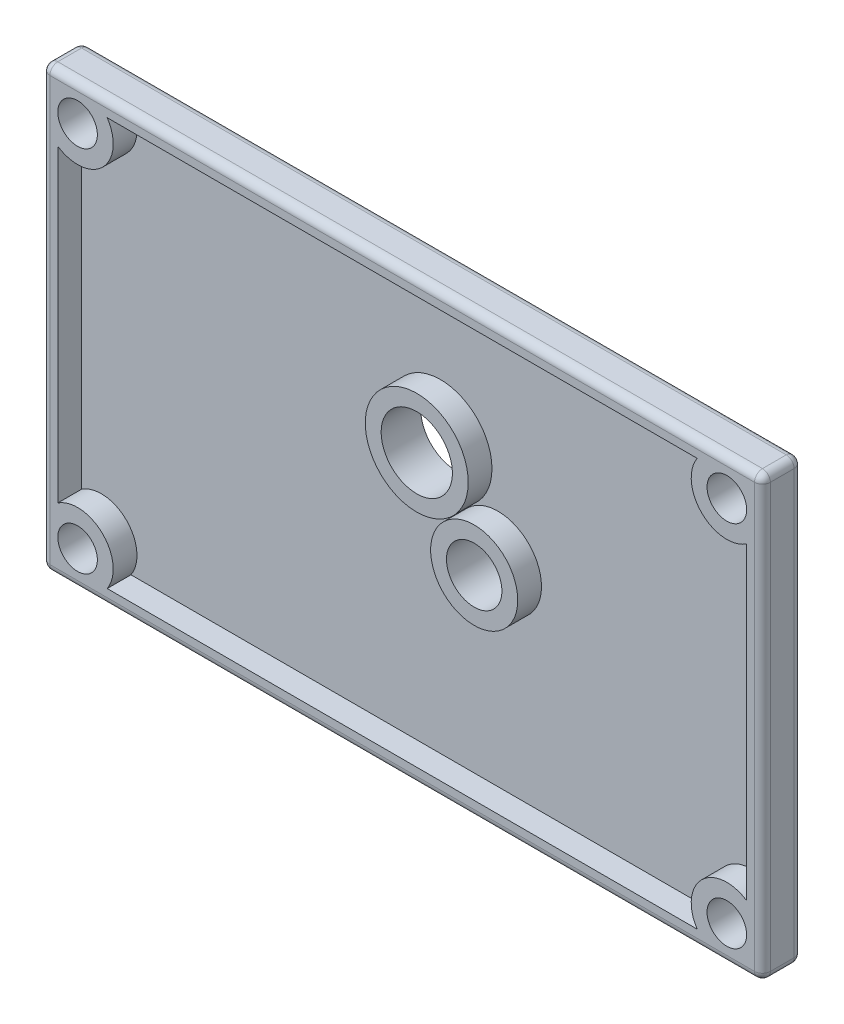
from build123d import *

# Parameters (mm, degrees)
SKETCH1_W           = 91
SKETCH1_H           = 55.5
BOSS_EXTRUDE1_DEPTH = 5
FILLET1_R           = 1
FILLET2_R           = 1
SKETCH3_R           = 2.5
SKETCH3_R_2         = 4.5
SKETCH3_R_3         = 3.5
CUT_EXTRUDE6_DEPTH  = 5
SHELL3_START        = 2
SHELL3_OUTLINE_R    = 5.5
SHELL3_OUTLINE_R_2  = 6.5
SHELL3_DEPTH        = 3


# Read off the part's stored shape, not the designer's step: Shell3
with BuildPart() as part:
    # Sketch1 → Boss-Extrude1 (new body)
    with BuildSketch(Plane.XY):
        with Locations((45.5, -27.75)):
            Rectangle(SKETCH1_W, SKETCH1_H)
    extrude(amount=BOSS_EXTRUDE1_DEPTH)

    # Fillet1
    fillet1_edges = [part.edges().sort_by_distance(p)[0] for p in [
        (0, -27.75, 5),
        (45.5, -55.5, 0),
        (0, -27.75, 0),
        (45.5, -55.5, 5),
        (0, 0, 2.5),
        (91, -55.5, 2.5),
        (0, -55.5, 2.5),
    ]]
    fillet(fillet1_edges, radius=FILLET1_R)

    # Fillet2
    # the kernel refuses this fillet: 1 mm, written as the material it takes off along each edge
    with BuildSketch(Plane(origin=(90, -54.5, 4), x_dir=(0, 0, 1), z_dir=(1, 0, 0))) as fillet2_piece_1_section:
        Polygon((0, 0), (FILLET2_R, 0), (FILLET2_R, FILLET2_R), (0, FILLET2_R), align=None)
    fillet2_piece_1 = extrude(amount=FILLET2_R, mode=Mode.PRIVATE)
    fillet2_piece_1 = fillet2_piece_1 - Plane(origin=(90, -54.5, 4), x_dir=(0, 0.7071067811865475, -0.7071067811865475), z_dir=(1, 0, 0)) * Sphere(FILLET2_R, mode=Mode.PRIVATE)
    add(fillet2_piece_1, mode=Mode.SUBTRACT)
    with BuildSketch(Plane(origin=(90, -54.5, 1), x_dir=(1, 0, 0), z_dir=(0, 0, -1))) as fillet2_piece_2_section:
        Polygon((0, 0), (FILLET2_R, 0), (FILLET2_R, FILLET2_R), (0, FILLET2_R), align=None)
    fillet2_piece_2 = extrude(amount=FILLET2_R, mode=Mode.PRIVATE)
    fillet2_piece_2 = fillet2_piece_2 - Plane(origin=(90, -54.5, 1), x_dir=(-0.7071067811865476, 0.7071067811865475, 0), z_dir=(0, 0, -1)) * Sphere(FILLET2_R, mode=Mode.PRIVATE)
    add(fillet2_piece_2, mode=Mode.SUBTRACT)
    with BuildSketch(Plane(origin=(1, -1, 4), x_dir=(0, 0, 1), z_dir=(0, 1, 0))) as fillet2_piece_3_section:
        Polygon((0, 0), (FILLET2_R, 0), (FILLET2_R, -FILLET2_R), (0, -FILLET2_R), align=None)
    fillet2_piece_3 = extrude(amount=FILLET2_R, mode=Mode.PRIVATE)
    fillet2_piece_3 = fillet2_piece_3 - Plane(origin=(1, -1, 4), x_dir=(0.7071067811865475, 0, -0.7071067811865475), z_dir=(0, 1, 0)) * Sphere(FILLET2_R, mode=Mode.PRIVATE)
    add(fillet2_piece_3, mode=Mode.SUBTRACT)
    with BuildSketch(Plane(origin=(1, -1, 1), x_dir=(0, 0, -1), z_dir=(0, 1, 0))) as fillet2_piece_4_section:
        Polygon((0, 0), (FILLET2_R, 0), (FILLET2_R, FILLET2_R), (0, FILLET2_R), align=None)
    fillet2_piece_4 = extrude(amount=FILLET2_R, mode=Mode.PRIVATE)
    fillet2_piece_4 = fillet2_piece_4 - Plane(origin=(1, -1, 1), x_dir=(0.7071067811865475, 0, 0.7071067811865475), z_dir=(0, 1, 0)) * Sphere(FILLET2_R, mode=Mode.PRIVATE)
    add(fillet2_piece_4, mode=Mode.SUBTRACT)
    with BuildSketch(Plane(origin=(90, -1, 4), x_dir=(1, 0, 0), z_dir=(0, 1, 0))) as fillet2_piece_5_section:
        Polygon((0, 0), (FILLET2_R, 0), (FILLET2_R, -FILLET2_R), (0, -FILLET2_R), align=None)
    fillet2_piece_5 = extrude(amount=FILLET2_R, mode=Mode.PRIVATE)
    fillet2_piece_5 = fillet2_piece_5 - Plane(origin=(90, -1, 4), x_dir=(-0.7071067811865475, 0, -0.7071067811865475), z_dir=(0, 1, 0)) * Sphere(FILLET2_R, mode=Mode.PRIVATE)
    add(fillet2_piece_5, mode=Mode.SUBTRACT)
    with BuildSketch(Plane(origin=(90, -1, 1), x_dir=(0, 0, -1), z_dir=(0, 1, 0))) as fillet2_piece_6_section:
        Polygon((0, 0), (FILLET2_R, 0), (FILLET2_R, -FILLET2_R), (0, -FILLET2_R), align=None)
    fillet2_piece_6 = extrude(amount=FILLET2_R, mode=Mode.PRIVATE)
    fillet2_piece_6 = fillet2_piece_6 - Plane(origin=(90, -1, 1), x_dir=(-0.7071067811865475, 0, 0.7071067811865475), z_dir=(0, 1, 0)) * Sphere(FILLET2_R, mode=Mode.PRIVATE)
    add(fillet2_piece_6, mode=Mode.SUBTRACT)
    with BuildSketch(Plane(origin=(91, -1, 5), x_dir=(0, 0, -1), z_dir=(0, -1, 0)), Plane(origin=(91, -1, 0), x_dir=(-1, 0, 0), z_dir=(0, -1, 0))) as fillet2_piece_7:
        with BuildLine():
            CenterArc((FILLET2_R, -FILLET2_R), FILLET2_R, 90, 90)
            Line((0, -FILLET2_R), (0, 0))
            Line((0, 0), (FILLET2_R, 0))
        make_face()
    extrude(amount=53.5, mode=Mode.SUBTRACT)
    with BuildSketch(Plane(origin=(1, 0, 0), x_dir=(0, 0, 1), z_dir=(1, 0, 0))) as fillet2_piece_8:
        with BuildLine():
            CenterArc((FILLET2_R, FILLET2_R), FILLET2_R, 180, 90)
            Line((0, FILLET2_R), (0, 0))
            Line((0, 0), (FILLET2_R, 0))
        make_face()
    extrude(amount=89, mode=Mode.SUBTRACT)
    with BuildSketch(Plane(origin=(1, 0, 5), x_dir=(0, 0, -1), z_dir=(1, 0, 0))) as fillet2_piece_9:
        with BuildLine():
            CenterArc((FILLET2_R, -FILLET2_R), FILLET2_R, 90, 90)
            Line((0, -FILLET2_R), (0, 0))
            Line((0, 0), (FILLET2_R, 0))
        make_face()
    extrude(amount=89, mode=Mode.SUBTRACT)
    with BuildSketch(Plane(origin=(91, 0, 1), x_dir=(-1, 0, 0), z_dir=(0, 0, 1))) as fillet2_piece_10:
        with BuildLine():
            CenterArc((FILLET2_R, FILLET2_R), FILLET2_R, 180, 90)
            Line((0, FILLET2_R), (0, 0))
            Line((0, 0), (FILLET2_R, 0))
        make_face()
    extrude(amount=3, mode=Mode.SUBTRACT)

    # Sketch3 → Cut-Extrude6 (cut)
    with BuildSketch(Plane(origin=(0, 0, 0), x_dir=(-1, 0, 0), z_dir=(0, 0, -1))):
        with Locations((-4.5, -51)):
            Circle(SKETCH3_R)
        with Locations((-47.337477188, -19.094515349)):
            Circle(SKETCH3_R_2)
        with Locations((-4.5, -4.5)):
            Circle(SKETCH3_R)
        with Locations((-54.590676617, -28.862157246)):
            Circle(SKETCH3_R_3)
        with Locations((-86.5, -4.5)):
            Circle(SKETCH3_R)
        with Locations((-86.5, -51)):
            Circle(SKETCH3_R)
    extrude(amount=-CUT_EXTRUDE6_DEPTH, mode=Mode.SUBTRACT)

    # Shell3 outline → Shell3 (cut)
    with BuildSketch(Plane.XY.offset(SHELL3_START)):
        with BuildLine():
            Line((2, -8.241657387), (2, -47.258342613))
            ThreePointArc((2, -47.258342613), (7.681980515, -47.818019485), (8.241657387, -53.5))
            Line((8.241657387, -53.5), (82.758342613, -53.5))
            ThreePointArc((82.758342613, -53.5), (83.318019485, -47.818019485), (89, -47.258342613))
            Line((89, -47.258342613), (89, -8.241657387))
            ThreePointArc((89, -8.241657387), (83.318019485, -7.681980515), (82.758342613, -2))
            Line((82.758342613, -2), (8.241657387, -2))
            ThreePointArc((8.241657387, -2), (7.681980515, -7.681980515), (2, -8.241657387))
        make_face()
        with Locations((54.590676617, -28.862157246)):
            Circle(SHELL3_OUTLINE_R, mode=Mode.SUBTRACT)
        with Locations((47.337477188, -19.094515349)):
            Circle(SHELL3_OUTLINE_R_2, mode=Mode.SUBTRACT)
    extrude(amount=SHELL3_DEPTH, mode=Mode.SUBTRACT)


solid = part.part
